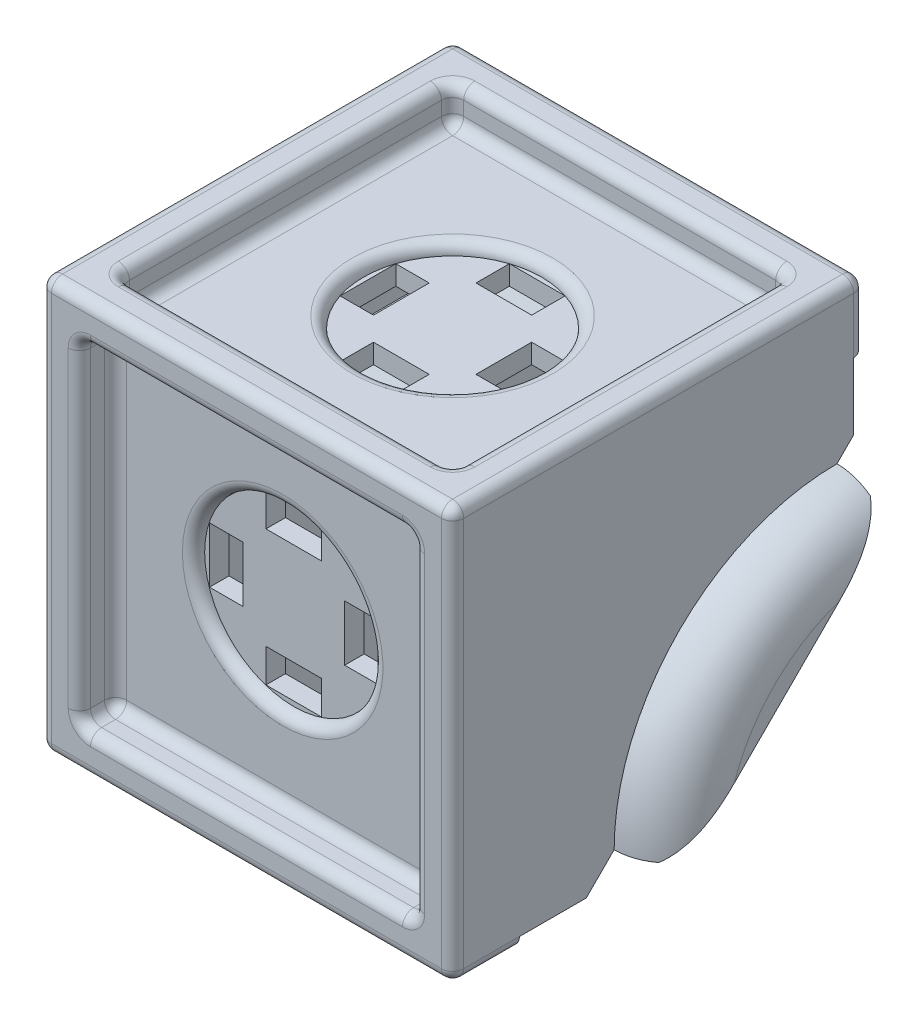
from build123d import *

# Parameters (mm, degrees)
SKETCH1_W           = 18.796
SKETCH1_H           = 18.796
BOSS_EXTRUDE1_DEPTH = 3.048
SKETCH3_W           = 18.796
SKETCH3_H           = 18.796
BOSS_EXTRUDE2_DEPTH = 3.048
SKETCH4_W           = 15.24
SKETCH4_H           = 15.24
CUT_EXTRUDE1_DEPTH  = 1.651
SKETCH5_W           = 15.24
SKETCH5_H           = 15.24
CUT_EXTRUDE2_DEPTH  = 1.651
BOSS_EXTRUDE3_DEPTH = 1.651
FILLET1_R           = 0.508
FILLET2_R           = 0.508
SKETCH7_W           = 2.54
SKETCH7_H           = 1.524
SKETCH7_W_2         = 1.524
SKETCH7_H_2         = 2.54
CUT_EXTRUDE5_DEPTH  = 5.08
SKETCH11_W          = 2.54
SKETCH11_H          = 1.524
SKETCH11_W_2        = 1.524
SKETCH11_H_2        = 2.54
CUT_EXTRUDE6_DEPTH  = 5.08
SKETCH12_R          = 4.064
CUT_EXTRUDE7_DEPTH  = 0.508
FILLET3_R           = 0.508
FILLET4_R           = 0.508
SKETCH13_R          = 4.064
CUT_EXTRUDE8_DEPTH  = 2.159
FILLET5_R           = 0.508
FILLET6_R           = 0.508
BOSS_EXTRUDE4_DEPTH = 15.24
BOSS_EXTRUDE5_DEPTH = 4.3561
CUT_EXTRUDE11_DEPTH = 12.7
BOSS_EXTRUDE6_DEPTH = 2.54
FILLET9_R           = 2.54
BOSS_EXTRUDE7_DEPTH = 2.54
FILLET11_R          = 2.54


# Some blends are built 0.0001 mm under size
with BuildPart() as part:
    # Sketch1 → Boss-Extrude1 (new body)
    with BuildSketch(Plane.XY):
        Rectangle(SKETCH1_W, SKETCH1_H)
    extrude(amount=-BOSS_EXTRUDE1_DEPTH)

    # Sketch3 → Boss-Extrude2 (add)
    with BuildSketch(Plane(origin=(0, 9.398, 0), x_dir=(1, 0, 0), z_dir=(0, 1, 0))):
        with Locations((0, 9.398)):
            Rectangle(SKETCH3_W, SKETCH3_H)
    extrude(amount=-BOSS_EXTRUDE2_DEPTH)

    # Sketch4 → Cut-Extrude1 (cut)
    with BuildSketch(Plane(origin=(0, 9.398, 0), x_dir=(1, 0, 0), z_dir=(0, 1, 0))):
        with Locations((0, 9.398)):
            Rectangle(SKETCH4_W, SKETCH4_H)
    extrude(amount=-CUT_EXTRUDE1_DEPTH, mode=Mode.SUBTRACT)

    # Sketch5 → Cut-Extrude2 (cut)
    with BuildSketch(Plane.XY):
        Rectangle(SKETCH5_W, SKETCH5_H)
    extrude(amount=-CUT_EXTRUDE2_DEPTH, mode=Mode.SUBTRACT)

    # Sketch8 → Boss-Extrude3 (add)
    with BuildSketch(Plane(origin=(9.398, 0, 0), x_dir=(0, 0, -1), z_dir=(1, 0, 0))):
        Polygon((3.048, 6.35), (3.048, -8.89), (6.096, -8.89), (7.366, -7.62), (7.874, -7.62), (17.526, 2.032), (17.526, 2.54), (18.288, 3.302), (18.288, 6.35), align=None)
    boss_extrude3 = extrude(amount=-BOSS_EXTRUDE3_DEPTH)

    # Fillet1
    fillet1_edges = [part.edges().sort_by_distance(p)[0] for p in [
        (7.62, 8.5725, -1.778),
        (-7.62, 8.5725, -1.778),
        (-7.62, 8.5725, -17.018),
        (7.62, 8.5725, -17.018),
    ]]
    fillet(fillet1_edges, radius=FILLET1_R)

    # Fillet2
    fillet2_edges = [part.edges().sort_by_distance(p)[0] for p in [
        (-7.62, -7.62, -0.8255),
        (-7.62, 7.62, -0.8255),
        (7.62, 7.62, -0.8255),
        (7.62, -7.62, -0.8255),
    ]]
    fillet(fillet2_edges, radius=FILLET2_R)

    # Mirror1: Boss-Extrude3 across plane
    add(boss_extrude3.mirror(Plane(origin=(0, 0, 0), x_dir=(0, 0, 1), z_dir=(1, 0, 0))))

    # Sketch7 → Cut-Extrude5 (cut)
    with BuildSketch(Plane.XY):
        with Locations((0, 3.08066434)):
            Rectangle(SKETCH7_W, SKETCH7_H)
        with Locations((3.08066434, 0)):
            Rectangle(SKETCH7_W_2, SKETCH7_H_2)
        with Locations((0, -3.08066434)):
            Rectangle(SKETCH7_W, SKETCH7_H)
        with Locations((-3.08066434, 0)):
            Rectangle(SKETCH7_W_2, SKETCH7_H_2)
    extrude(amount=-CUT_EXTRUDE5_DEPTH, mode=Mode.SUBTRACT)

    # Sketch11 → Cut-Extrude6 (cut)
    with BuildSketch(Plane(origin=(0, 9.398, 0), x_dir=(1, 0, 0), z_dir=(0, 1, 0))):
        with Locations((0, 12.496465775)):
            Rectangle(SKETCH11_W, SKETCH11_H)
        with Locations((3.098465775, 9.398)):
            Rectangle(SKETCH11_W_2, SKETCH11_H_2)
        with Locations((0, 6.299534225)):
            Rectangle(SKETCH11_W, SKETCH11_H)
        with Locations((-3.098465775, 9.398)):
            Rectangle(SKETCH11_W_2, SKETCH11_H_2)
    extrude(amount=-CUT_EXTRUDE6_DEPTH, mode=Mode.SUBTRACT)

    # Sketch12 → Cut-Extrude7 (cut)
    with BuildSketch(Plane(origin=(0, 7.747, 0), x_dir=(1, 0, 0), z_dir=(0, 1, 0))):
        with Locations(Location((0, 9.398, 0), (0, 0, 270))):
            Circle(SKETCH12_R)
    extrude(amount=-CUT_EXTRUDE7_DEPTH, mode=Mode.SUBTRACT)

    # Fillet3
    fillet3_edges = [part.edges().sort_by_distance(p)[0] for p in [
        (0, 7.747, -13.462),
    ]]
    fillet(fillet3_edges, radius=FILLET3_R - 0.0001)  # a hair under: the kernel refuses the full size

    # Fillet4
    fillet4_edges = [part.edges().sort_by_distance(p)[0] for p in [
        (-7.62, 0, 0),
        (-7.62, 0, -1.651),
        (0, 7.62, 0),
        (0, 7.62, -1.651),
        (0, -7.62, -1.651),
        (7.62, 0, -1.651),
        (7.471210245, 7.471210245, -1.651),
        (-7.471210245, -7.471210245, -1.651),
        (7.471210245, -7.471210245, -1.651),
        (-7.471210245, 7.471210245, -1.651),
        (7.62, 0, 0),
        (0, -7.62, 0),
        (-7.471210245, 7.471210245, 0),
        (7.471210245, -7.471210245, 0),
        (-7.471210245, -7.471210245, 0),
        (7.471210245, 7.471210245, 0),
        (0, 9.398, -1.778),
        (0, 7.747, -1.778),
        (-7.62, 9.398, -9.398),
        (-7.62, 7.747, -9.398),
        (7.62, 7.747, -9.398),
        (0, 7.747, -17.018),
        (-7.471210245, 7.747, -16.869210245),
        (7.471210245, 7.747, -16.869210245),
        (7.471210245, 7.747, -1.926789755),
        (-7.471210245, 7.747, -1.926789755),
        (7.62, 9.398, -9.398),
        (0, 9.398, -17.018),
        (-7.471210245, 9.398, -1.926789755),
        (7.471210245, 9.398, -1.926789755),
        (7.471210245, 9.398, -16.869210245),
        (-7.471210245, 9.398, -16.869210245),
    ]]
    fillet(fillet4_edges, radius=FILLET4_R)

    # Sketch13 → Cut-Extrude8 (cut)
    with BuildSketch(Plane.XY):
        Circle(SKETCH13_R)
    extrude(amount=-CUT_EXTRUDE8_DEPTH, mode=Mode.SUBTRACT)

    # Fillet5
    fillet5_edges = [part.edges().sort_by_distance(p)[0] for p in [
        (-4.064, 0, -1.651),
    ]]
    fillet(fillet5_edges, radius=FILLET5_R - 0.0001)  # a hair under: the kernel refuses the full size

    # Fillet6
    fillet6_edges = [part.edges().sort_by_distance(p)[0] for p in [
        (-9.398, -9.398, -1.524),
        (-9.398, 7.874, -18.796),
        (0, 9.398, -18.796),
        (-9.398, 9.398, -9.398),
        (-9.398, 0, 0),
        (9.398, 7.874, -18.796),
        (9.398, -9.398, -1.524),
        (0, -9.398, 0),
        (9.398, 0, 0),
        (9.398, 9.398, -9.398),
        (0, 9.398, 0),
    ]]
    fillet(fillet6_edges, radius=FILLET6_R)

    # Sketch14 → Boss-Extrude4 (add)
    with BuildSketch(Plane(origin=(0, 0, -3.048), x_dir=(-1, 0, 0), z_dir=(0, 0, -1))):
        Polygon((-7.747, 0.96249216), (-2.178609242, 1.813398025), (-2.178609242, -6.100026522), (-7.747, -6.100026522), (-7.747, -7.12111356), (-1.582975136, -7.12111356), (1.582975136, -7.12111356), (7.747, -7.12111356), (7.747, -6.100026522), (2.178609242, -6.100026522), (2.178609242, 1.813398025), (7.747, 0.96249216), (7.747, 1.892560342), (1.582975136, 2.834485063), (1.582975136, -6.100026522), (-1.582975136, -6.100026522), (-1.582975136, 2.834485063), (-7.747, 1.892560342), align=None)
    extrude(amount=BOSS_EXTRUDE4_DEPTH)

    # Sketch15 → Boss-Extrude5 (add)
    with BuildSketch(Plane(origin=(2.178609242, 0, 0), x_dir=(0, 0, -1), z_dir=(1, 0, 0))):
        with BuildLine():
            Line((9.029782906, -13.262742395), (9.029782906, 1.135001064))
            Line((9.029782906, 1.135001064), (23.004063321, 1.135001064))
            Line((23.004063321, 1.135001064), (23.004063321, 0.252786391))
            ThreePointArc((23.004063321, 0.252786391), (13.620185086, -3.736867225), (9.982574752, -13.262742395))
            Line((9.982574752, -13.262742395), (9.029782906, -13.262742395))
        make_face()
    extrude(amount=-BOSS_EXTRUDE5_DEPTH)

    # Sketch16 → Cut-Extrude11 (cut, symmetric)
    with BuildSketch(Plane(origin=(2.178609242, 0, 0), x_dir=(0, 0, -1), z_dir=(1, 0, 0))):
        with BuildLine():
            Line((23.004063321, 0.252786391), (23.004063321, -12.777731634))
            Line((23.004063321, -12.777731634), (9.973545297, -12.777731634))
            ThreePointArc((9.973545297, -12.777731634), (13.790095664, -3.563763976), (23.004063321, 0.252786391))
        make_face()
    extrude(amount=CUT_EXTRUDE11_DEPTH, both=True, mode=Mode.SUBTRACT)

    # Sketch17 → Boss-Extrude6 (add)
    with BuildSketch(Plane(origin=(9.398, 0, 0), x_dir=(0, 0, -1), z_dir=(1, 0, 0))):
        with BuildLine():
            Line((7.874, -7.62), (7.366, -7.62))
            ThreePointArc((7.366, -7.62), (10.341795103, -0.435795103), (17.526, 2.54))
            Line((17.526, 2.54), (17.526, 2.032))
            Line((17.526, 2.032), (7.874, -7.62))
        make_face()
    extrude(amount=BOSS_EXTRUDE6_DEPTH)

    # Fillet9
    # the kernel refuses this fillet: 2.54 mm, written as the material it takes off along each edge
    with BuildSketch(Plane(origin=(11.938, -7.62, -17.526), x_dir=(0, -0.5853008610590893, 0.8108161949810133), z_dir=(0, -0.8108161949810133, -0.5853008610590893))) as fillet9_piece_1:
        with BuildLine():
            CenterArc((10.16 - FILLET9_R, FILLET9_R), FILLET9_R, 270, 90)
            Line((10.16 - FILLET9_R, 0), (10.16, 0))
            Line((10.16, 0), (10.16, FILLET9_R))
        make_face()
    revolve(axis=Axis((11.938, -7.62, -17.526), (-1, 0, 0)), revolution_arc=161.648494619, mode=Mode.SUBTRACT)

    # Mirror2: Boss-Extrude3 across plane
    add(boss_extrude3.mirror(Plane(origin=(0, 0, 0), x_dir=(0, 0, 1), z_dir=(1, 0, 0))))

    # Sketch19 → Boss-Extrude7 (add)
    with BuildSketch(Plane.ZY.offset(9.398)):
        with BuildLine():
            Line((-17.526, 2.032), (-17.526, 2.54))
            ThreePointArc((-17.526, 2.54), (-10.341795103, -0.435795103), (-7.366, -7.62))
            Line((-7.366, -7.62), (-7.874, -7.62))
            Line((-7.874, -7.62), (-17.526, 2.032))
        make_face()
    extrude(amount=BOSS_EXTRUDE7_DEPTH)

    # Fillet11
    fillet11_edges = [part.edges().sort_by_distance(p)[0] for p in [
        (-11.938, -0.435795103, -10.341795103),
    ]]
    fillet(fillet11_edges, radius=FILLET11_R - 0.0001)  # a hair under: the kernel refuses the full size


solid = part.part
